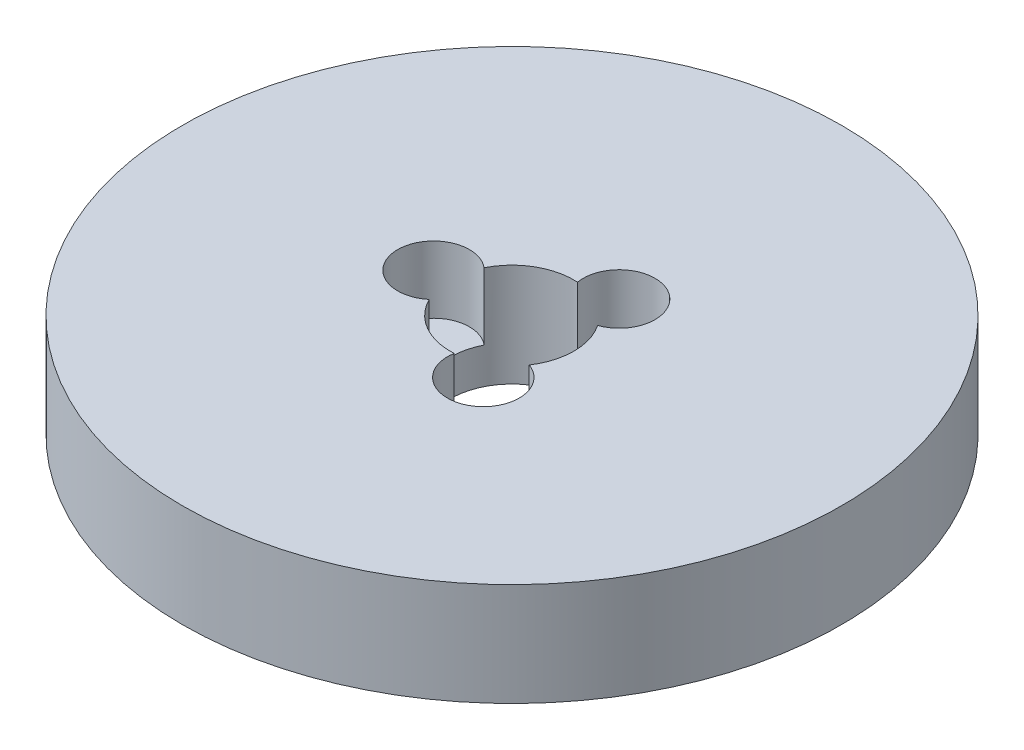
from build123d import *

# Parameters (mm, degrees)
SKETCH1_R           = 80
BOSS_EXTRUDE1_DEPTH = 25
SKETCH2_R           = 15
CUT_EXTRUDE1_DEPTH  = 116.866302263
SKETCH3_R           = 8.707947945
CUT_EXTRUDE2_DEPTH  = 16.24375192
CIRPATTERN1_COUNT   = 3


with BuildPart() as part:
    # Sketch1 → Boss-Extrude1 (new body)
    with BuildSketch(Plane(origin=(0, 0, 0), x_dir=(1, 0, 0), z_dir=(0, 1, 0))):
        Circle(SKETCH1_R)
    extrude(amount=BOSS_EXTRUDE1_DEPTH)

    # Sketch2 → Cut-Extrude1 (cut, through all)
    with BuildSketch(Plane(origin=(0, 0, 0), x_dir=(1, 0, 0), z_dir=(0, 1, 0))):
        Circle(SKETCH2_R)
    extrude(amount=CUT_EXTRUDE1_DEPTH, mode=Mode.SUBTRACT)

    # Sketch3 → Cut-Extrude2 (cut)
    with BuildSketch(Plane(origin=(0, 25, 0), x_dir=(1, 0, 0), z_dir=(0, 1, 0))):
        with Locations((-19.041045363, 0)):
            Circle(SKETCH3_R)
    cut_extrude2 = extrude(amount=-CUT_EXTRUDE2_DEPTH, mode=Mode.SUBTRACT)

    # CirPattern1: Cut-Extrude2 ×3 about axis
    cirpattern1_axis = Axis((0, 0, 0), (0, 1, 0))
    for i in range(1, CIRPATTERN1_COUNT):
        add(cut_extrude2.rotate(cirpattern1_axis, i * 360 / CIRPATTERN1_COUNT), mode=Mode.SUBTRACT)


solid = part.part
